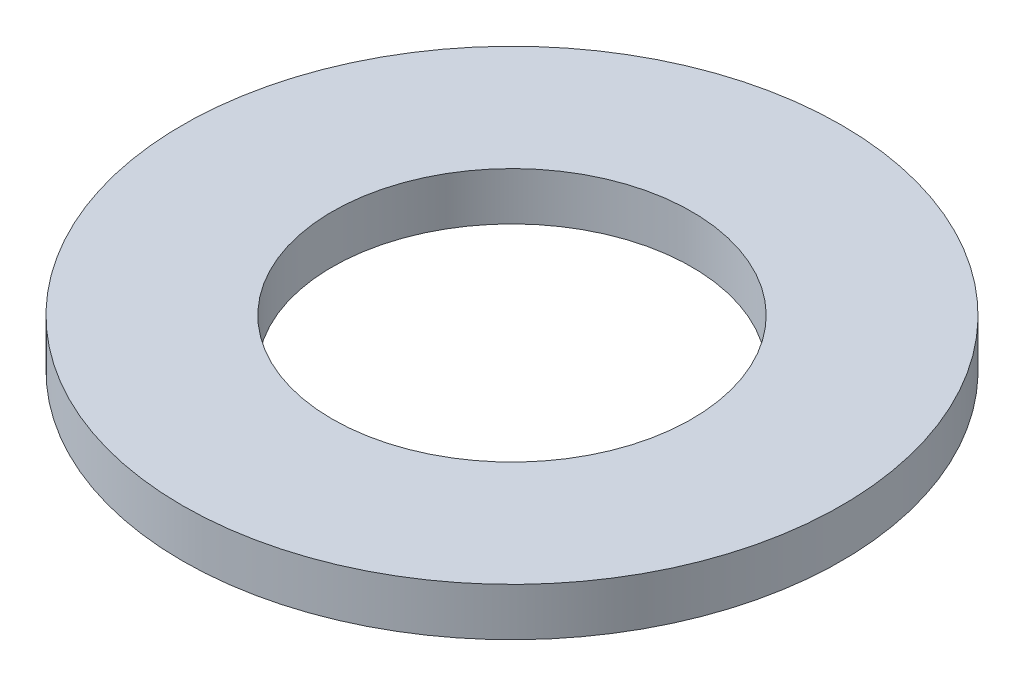
from build123d import *

# Parameters (mm, degrees)
SKETCH1_R           = 55
BOSS_EXTRUDE1_DEPTH = 8
SKETCH2_R           = 30
CUT_EXTRUDE1_DEPTH  = 79.192071209


with BuildPart() as part:
    # Sketch1 → Boss-Extrude1 (new body)
    with BuildSketch(Plane(origin=(0, 0, 0), x_dir=(1, 0, 0), z_dir=(0, 1, 0))):
        Circle(SKETCH1_R)
    extrude(amount=BOSS_EXTRUDE1_DEPTH)

    # Sketch2 → Cut-Extrude1 (cut, through all)
    with BuildSketch(Plane(origin=(0, 0, 0), x_dir=(1, 0, 0), z_dir=(0, 1, 0))):
        Circle(SKETCH2_R)
    extrude(amount=CUT_EXTRUDE1_DEPTH, mode=Mode.SUBTRACT)


solid = part.part
